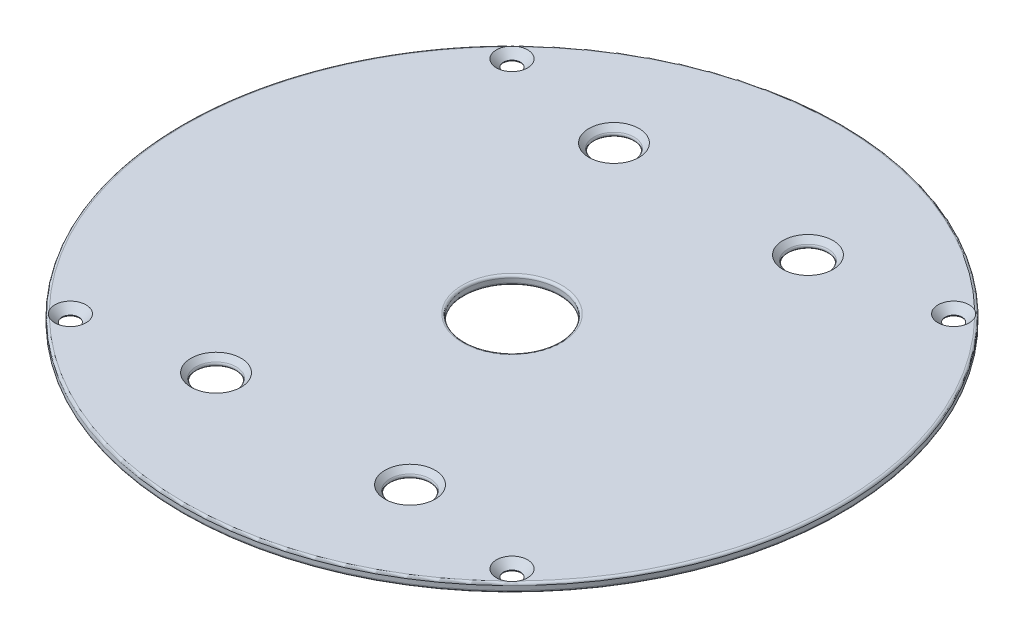
from build123d import *

# Parameters (mm, degrees)
SKETCH1_R           = 69.65
SKETCH1_R_2         = 2.3
SKETCH1_R_3         = 10
SKETCH1_R_4         = 1.8
BOSS_EXTRUDE1_DEPTH = 1.9
CHAMFER1_SIZE       = 3
CHAMFER3_SIZE       = 1.5
FILLET2_R           = 0.5


with BuildPart() as part:
    # Sketch1 → Boss-Extrude1 (new body)
    with BuildSketch(Plane(origin=(0, 0, 0), x_dir=(1, 0, 0), z_dir=(0, 1, 0))):
        with Locations(Location((0, 0, 0), (0, 0, 90))):
            Circle(SKETCH1_R)
        with Locations(Location((-20.5, 42.05, 0), (0, 0, 90))):
            Circle(SKETCH1_R_2, mode=Mode.SUBTRACT)
        with Locations(Location((20.5, 42.05, 0), (0, 0, 90))):
            Circle(SKETCH1_R_2, mode=Mode.SUBTRACT)
        with Locations(Location((20.5, -42.05, 0), (0, 0, 90))):
            Circle(SKETCH1_R_2, mode=Mode.SUBTRACT)
        with Locations(Location((-20.5, -42.05, 0), (0, 0, 90))):
            Circle(SKETCH1_R_2, mode=Mode.SUBTRACT)
        with Locations(Location((0, 0, 0), (0, 0, 90))):
            Circle(SKETCH1_R_3, mode=Mode.SUBTRACT)
        with Locations(Location((-46.669047558, 46.669047558, 0), (0, 0, 90))):
            Circle(SKETCH1_R_4, mode=Mode.SUBTRACT)
        with Locations(Location((46.669047558, 46.669047558, 0), (0, 0, 90))):
            Circle(SKETCH1_R_4, mode=Mode.SUBTRACT)
        with Locations(Location((46.669047558, -46.669047558, 0), (0, 0, 90))):
            Circle(SKETCH1_R_4, mode=Mode.SUBTRACT)
        with Locations(Location((-46.669047558, -46.669047558, 0), (0, 0, 90))):
            Circle(SKETCH1_R_4, mode=Mode.SUBTRACT)
    extrude(amount=BOSS_EXTRUDE1_DEPTH)

    # Chamfer1
    # the kernel refuses this chamfer: 3 mm, written as the material it takes off along each edge
    with BuildSketch(Plane(origin=(-20.5, 1.9, -42.05), x_dir=(0, 0, -1), z_dir=(1, 0, 0))) as chamfer1_piece_1:
        Polygon((2.3, -CHAMFER1_SIZE), (2.3 + CHAMFER1_SIZE, 0), (2.3, 0), align=None)
    revolve(axis=Axis((-20.5, 1.9, -42.05), (0, 1, 0)), mode=Mode.SUBTRACT)
    with BuildSketch(Plane(origin=(20.5, 1.9, -42.05), x_dir=(0, 0, -1), z_dir=(1, 0, 0))) as chamfer1_piece_2:
        Polygon((2.3, -CHAMFER1_SIZE), (2.3 + CHAMFER1_SIZE, 0), (2.3, 0), align=None)
    revolve(axis=Axis((20.5, 1.9, -42.05), (0, 1, 0)), mode=Mode.SUBTRACT)
    with BuildSketch(Plane(origin=(20.5, 1.9, 42.05), x_dir=(0, 0, -1), z_dir=(1, 0, 0))) as chamfer1_piece_3:
        Polygon((2.3, -CHAMFER1_SIZE), (2.3 + CHAMFER1_SIZE, 0), (2.3, 0), align=None)
    revolve(axis=Axis((20.5, 1.9, 42.05), (0, 1, 0)), mode=Mode.SUBTRACT)
    with BuildSketch(Plane(origin=(-20.5, 1.9, 42.05), x_dir=(0, 0, -1), z_dir=(1, 0, 0))) as chamfer1_piece_4:
        Polygon((2.3, -CHAMFER1_SIZE), (2.3 + CHAMFER1_SIZE, 0), (2.3, 0), align=None)
    revolve(axis=Axis((-20.5, 1.9, 42.05), (0, 1, 0)), mode=Mode.SUBTRACT)

    # Chamfer3
    chamfer3_edges = [part.edges().sort_by_distance(p)[0] for p in [
        (-46.669047558, 1.9, 48.469047558),
        (46.669047558, 1.9, 48.469047558),
        (46.669047558, 1.9, -44.869047558),
        (-46.669047558, 1.9, -44.869047558),
    ]]
    chamfer(chamfer3_edges, length=CHAMFER3_SIZE)

    # Fillet2
    # the kernel refuses this fillet: 0.5 mm, written as the material it takes off along each edge
    with BuildSketch(Plane(origin=(0, 0, 0), x_dir=(0, 0, -1), z_dir=(1, 0, 0))) as fillet2_piece_1:
        with BuildLine():
            CenterArc((69.65 - FILLET2_R, FILLET2_R), FILLET2_R, 270, 90)
            Line((69.65 - FILLET2_R, 0), (69.65 - FILLET2_R, -FILLET2_R * 0.02))
            Line((69.65 - FILLET2_R, -FILLET2_R * 0.02), (69.65 + FILLET2_R * 0.02, -FILLET2_R * 0.02))
            Line((69.65 + FILLET2_R * 0.02, -FILLET2_R * 0.02), (69.65 + FILLET2_R * 0.02, FILLET2_R))
            Line((69.65 + FILLET2_R * 0.02, FILLET2_R), (69.65, FILLET2_R))
        make_face()
    revolve(axis=Axis((0, 0, 0), (0, 1, 0)), mode=Mode.SUBTRACT)
    with BuildSketch(Plane(origin=(0, 0, 0), x_dir=(0, 0, -1), z_dir=(1, 0, 0))) as fillet2_piece_2:
        with BuildLine():
            CenterArc((10 + FILLET2_R, FILLET2_R), FILLET2_R, 180, 90)
            Line((10 + FILLET2_R, 0), (10 + FILLET2_R, -FILLET2_R * 0.02))
            Line((10 + FILLET2_R, -FILLET2_R * 0.02), (10 - FILLET2_R * 0.02, -FILLET2_R * 0.02))
            Line((10 - FILLET2_R * 0.02, -FILLET2_R * 0.02), (10 - FILLET2_R * 0.02, FILLET2_R))
            Line((10 - FILLET2_R * 0.02, FILLET2_R), (10, FILLET2_R))
        make_face()
    revolve(axis=Axis((0, 0, 0), (0, 1, 0)), mode=Mode.SUBTRACT)
    with BuildSketch(Plane(origin=(-46.669047558, 0, -46.669047558), x_dir=(0, 0, -1), z_dir=(1, 0, 0))) as fillet2_piece_3:
        with BuildLine():
            CenterArc((2.289897949, 0.5), FILLET2_R, 191.536959033, 78.463040967)
            Line((1.8, 0.4), (1.790202041, 0.398))
            ThreePointArc((1.790202041, 0.398), (1.79, 0.2), (1.79, 0))
            Line((1.79, 0), (1.8, -0.01))
            Line((1.8, -0.01), (2.289897949, -0.01))
            Line((2.289897949, -0.01), (2.289897949, 0))
        make_face()
    revolve(axis=Axis((-46.669047558, 0, -46.669047558), (0, 1, 0)), mode=Mode.SUBTRACT)
    with BuildSketch(Plane(origin=(46.669047558, 0, -46.669047558), x_dir=(0, 0, -1), z_dir=(1, 0, 0))) as fillet2_piece_4:
        with BuildLine():
            CenterArc((2.289897949, 0.5), FILLET2_R, 191.536959033, 78.463040967)
            Line((1.8, 0.4), (1.790202041, 0.398))
            ThreePointArc((1.790202041, 0.398), (1.79, 0.2), (1.79, 0))
            Line((1.79, 0), (1.8, -0.01))
            Line((1.8, -0.01), (2.289897949, -0.01))
            Line((2.289897949, -0.01), (2.289897949, 0))
        make_face()
    revolve(axis=Axis((46.669047558, 0, -46.669047558), (0, 1, 0)), mode=Mode.SUBTRACT)
    with BuildSketch(Plane(origin=(46.669047558, 0, 46.669047558), x_dir=(0, 0, -1), z_dir=(1, 0, 0))) as fillet2_piece_5:
        with BuildLine():
            CenterArc((2.289897949, 0.5), FILLET2_R, 191.536959033, 78.463040967)
            Line((1.8, 0.4), (1.790202041, 0.398))
            ThreePointArc((1.790202041, 0.398), (1.79, 0.2), (1.79, 0))
            Line((1.79, 0), (1.8, -0.01))
            Line((1.8, -0.01), (2.289897949, -0.01))
            Line((2.289897949, -0.01), (2.289897949, 0))
        make_face()
    revolve(axis=Axis((46.669047558, 0, 46.669047558), (0, 1, 0)), mode=Mode.SUBTRACT)
    with BuildSketch(Plane(origin=(-46.669047558, 0, 46.669047558), x_dir=(0, 0, -1), z_dir=(1, 0, 0))) as fillet2_piece_6:
        with BuildLine():
            CenterArc((2.289897949, 0.5), FILLET2_R, 191.536959033, 78.463040967)
            Line((2.289897949, 0), (2.289897949, -0.01))
            Line((2.289897949, -0.01), (1.8, -0.01))
            Line((1.8, -0.01), (1.79, 0))
            ThreePointArc((1.79, 0), (1.79, 0.2), (1.790202041, 0.398))
            Line((1.790202041, 0.398), (1.8, 0.4))
        make_face()
    revolve(axis=Axis((-46.669047558, 0, 46.669047558), (0, 1, 0)), mode=Mode.SUBTRACT)
    with BuildSketch(Plane(origin=(-20.5, 0, 42.05), x_dir=(0, 0, -1), z_dir=(1, 0, 0))) as fillet2_piece_7:
        with BuildLine():
            CenterArc((3.4 + FILLET2_R * 2.41421356237, FILLET2_R), FILLET2_R, 135, 135)
            Line((3.4 + FILLET2_R * 2.41421356237, 0), (3.4 + FILLET2_R * 2.41421356237, -FILLET2_R * 0.02))
            Line((3.4 + FILLET2_R * 2.41421356237, -FILLET2_R * 0.02), (3.4, -FILLET2_R * 0.02))
            Line((3.4, -FILLET2_R * 0.02), (3.4 - FILLET2_R * 0.0141421356237, FILLET2_R * 0.0141421356237))
            Line((3.4 - FILLET2_R * 0.0141421356237, FILLET2_R * 0.0141421356237), (3.4 + FILLET2_R * 1.69296464556, FILLET2_R * 1.72124891681))
            Line((3.4 + FILLET2_R * 1.69296464556, FILLET2_R * 1.72124891681), (3.4 + FILLET2_R * 1.70710678119, FILLET2_R * 1.70710678119))
        make_face()
    revolve(axis=Axis((-20.5, 0, 42.05), (0, 1, 0)), mode=Mode.SUBTRACT)
    with BuildSketch(Plane(origin=(20.5, 0, 42.05), x_dir=(0, 0, -1), z_dir=(1, 0, 0))) as fillet2_piece_8:
        with BuildLine():
            CenterArc((3.4 + FILLET2_R * 2.41421356237, FILLET2_R), FILLET2_R, 135, 135)
            Line((3.4 + FILLET2_R * 2.41421356237, 0), (3.4 + FILLET2_R * 2.41421356237, -FILLET2_R * 0.02))
            Line((3.4 + FILLET2_R * 2.41421356237, -FILLET2_R * 0.02), (3.4, -FILLET2_R * 0.02))
            Line((3.4, -FILLET2_R * 0.02), (3.4 - FILLET2_R * 0.0141421356237, FILLET2_R * 0.0141421356237))
            Line((3.4 - FILLET2_R * 0.0141421356237, FILLET2_R * 0.0141421356237), (3.4 + FILLET2_R * 1.69296464556, FILLET2_R * 1.72124891681))
            Line((3.4 + FILLET2_R * 1.69296464556, FILLET2_R * 1.72124891681), (3.4 + FILLET2_R * 1.70710678119, FILLET2_R * 1.70710678119))
        make_face()
    revolve(axis=Axis((20.5, 0, 42.05), (0, 1, 0)), mode=Mode.SUBTRACT)
    with BuildSketch(Plane(origin=(20.5, 0, -42.05), x_dir=(0, 0, -1), z_dir=(1, 0, 0))) as fillet2_piece_9:
        with BuildLine():
            CenterArc((3.4 + FILLET2_R * 2.41421356237, FILLET2_R), FILLET2_R, 135, 135)
            Line((3.4 + FILLET2_R * 2.41421356237, 0), (3.4 + FILLET2_R * 2.41421356237, -FILLET2_R * 0.02))
            Line((3.4 + FILLET2_R * 2.41421356237, -FILLET2_R * 0.02), (3.4, -FILLET2_R * 0.02))
            Line((3.4, -FILLET2_R * 0.02), (3.4 - FILLET2_R * 0.0141421356237, FILLET2_R * 0.0141421356237))
            Line((3.4 - FILLET2_R * 0.0141421356237, FILLET2_R * 0.0141421356237), (3.4 + FILLET2_R * 1.69296464556, FILLET2_R * 1.72124891681))
            Line((3.4 + FILLET2_R * 1.69296464556, FILLET2_R * 1.72124891681), (3.4 + FILLET2_R * 1.70710678119, FILLET2_R * 1.70710678119))
        make_face()
    revolve(axis=Axis((20.5, 0, -42.05), (0, 1, 0)), mode=Mode.SUBTRACT)
    with BuildSketch(Plane(origin=(-20.5, 0, -42.05), x_dir=(0, 0, -1), z_dir=(1, 0, 0))) as fillet2_piece_10:
        with BuildLine():
            CenterArc((3.4 + FILLET2_R * 2.41421356237, FILLET2_R), FILLET2_R, 135, 135)
            Line((3.4 + FILLET2_R * 2.41421356237, 0), (3.4 + FILLET2_R * 2.41421356237, -FILLET2_R * 0.02))
            Line((3.4 + FILLET2_R * 2.41421356237, -FILLET2_R * 0.02), (3.4, -FILLET2_R * 0.02))
            Line((3.4, -FILLET2_R * 0.02), (3.4 - FILLET2_R * 0.0141421356237, FILLET2_R * 0.0141421356237))
            Line((3.4 - FILLET2_R * 0.0141421356237, FILLET2_R * 0.0141421356237), (3.4 + FILLET2_R * 1.69296464556, FILLET2_R * 1.72124891681))
            Line((3.4 + FILLET2_R * 1.69296464556, FILLET2_R * 1.72124891681), (3.4 + FILLET2_R * 1.70710678119, FILLET2_R * 1.70710678119))
        make_face()
    revolve(axis=Axis((-20.5, 0, -42.05), (0, 1, 0)), mode=Mode.SUBTRACT)
    with BuildSketch(Plane(origin=(0, 1.9, 0), x_dir=(0, 0, -1), z_dir=(1, 0, 0))) as fillet2_piece_11:
        with BuildLine():
            CenterArc((10 + FILLET2_R, -FILLET2_R), FILLET2_R, 90, 90)
            Line((10, -FILLET2_R), (10 - FILLET2_R * 0.02, -FILLET2_R))
            Line((10 - FILLET2_R * 0.02, -FILLET2_R), (10 - FILLET2_R * 0.02, FILLET2_R * 0.02))
            Line((10 - FILLET2_R * 0.02, FILLET2_R * 0.02), (10 + FILLET2_R, FILLET2_R * 0.02))
            Line((10 + FILLET2_R, FILLET2_R * 0.02), (10 + FILLET2_R, 0))
        make_face()
    revolve(axis=Axis((0, 1.9, 0), (0, 1, 0)), mode=Mode.SUBTRACT)
    with BuildSketch(Plane(origin=(0, 1.9, 0), x_dir=(0, 0, -1), z_dir=(1, 0, 0))) as fillet2_piece_12:
        with BuildLine():
            CenterArc((69.65 - FILLET2_R, -FILLET2_R), FILLET2_R, 0, 90)
            Line((69.65, -FILLET2_R), (69.65 + FILLET2_R * 0.02, -FILLET2_R))
            Line((69.65 + FILLET2_R * 0.02, -FILLET2_R), (69.65 + FILLET2_R * 0.02, FILLET2_R * 0.02))
            Line((69.65 + FILLET2_R * 0.02, FILLET2_R * 0.02), (69.65 - FILLET2_R, FILLET2_R * 0.02))
            Line((69.65 - FILLET2_R, FILLET2_R * 0.02), (69.65 - FILLET2_R, 0))
        make_face()
    revolve(axis=Axis((0, 1.9, 0), (0, 1, 0)), mode=Mode.SUBTRACT)


solid = part.part
